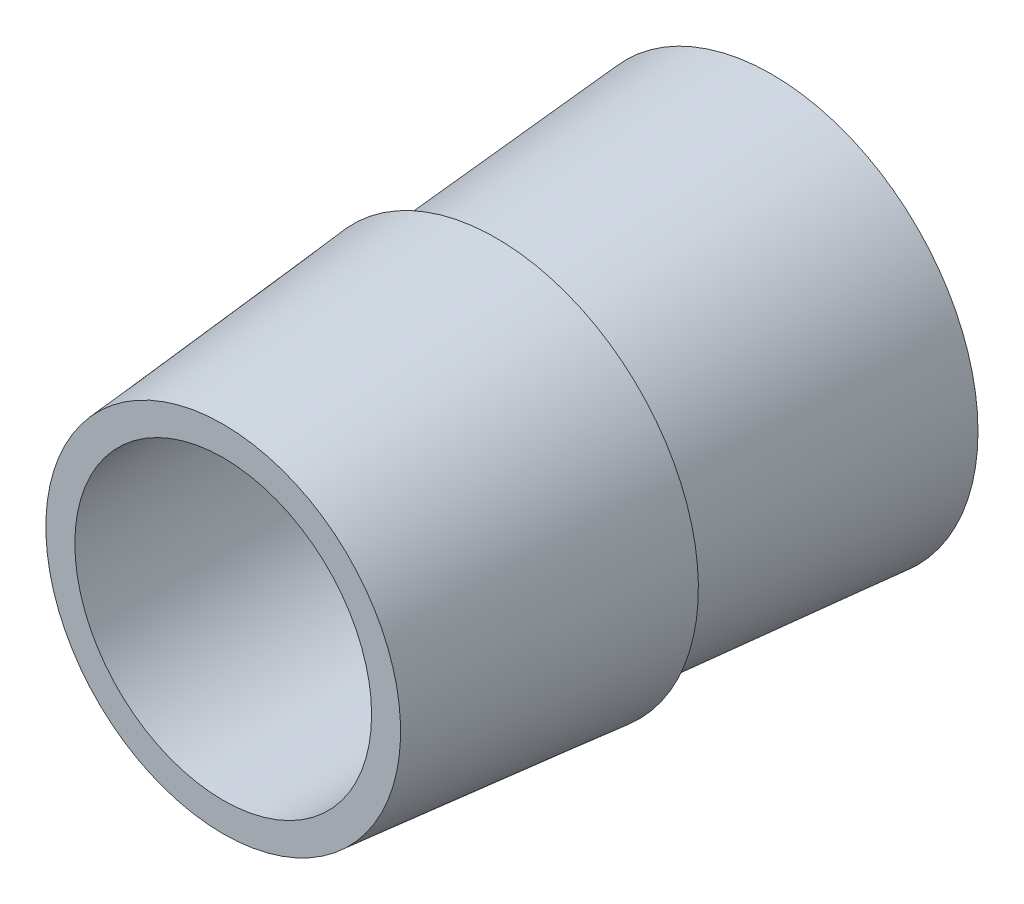
from build123d import *

# Parameters (mm, degrees)
SKETCH3_R          = 2.5
CUT_EXTRUDE1_DEPTH = 12.095934474


with BuildPart() as part:
    # Sketch2 → Revolve2 (revolve)
    with BuildSketch(Plane(origin=(0, 0, 0), x_dir=(0, 0, -1), z_dir=(1, 0, 0))):
        Polygon((-0.677185359, 1.218766529), (-0.677185359, -1.587300884), (8.565327607, -1.587300884), (8.565327607, 1.587300884), (8.565327607, 1.887300884), (3.922595891, 1.518766529), (3.922595891, 1.818766529), (-0.677185359, 1.401329029), align=None)
    revolve(axis=Axis((0, -1.587300884, 0.677185359), (0, 0, -1)))

    # Sketch3 → Cut-Extrude1 (cut, through all)
    with BuildSketch(Plane(origin=(0, 0, -8.565327607), x_dir=(-1, 0, 0), z_dir=(0, 0, -1))):
        with Locations((0, -1.587300884)):
            Circle(SKETCH3_R)
    extrude(amount=-CUT_EXTRUDE1_DEPTH, mode=Mode.SUBTRACT)


solid = part.part
